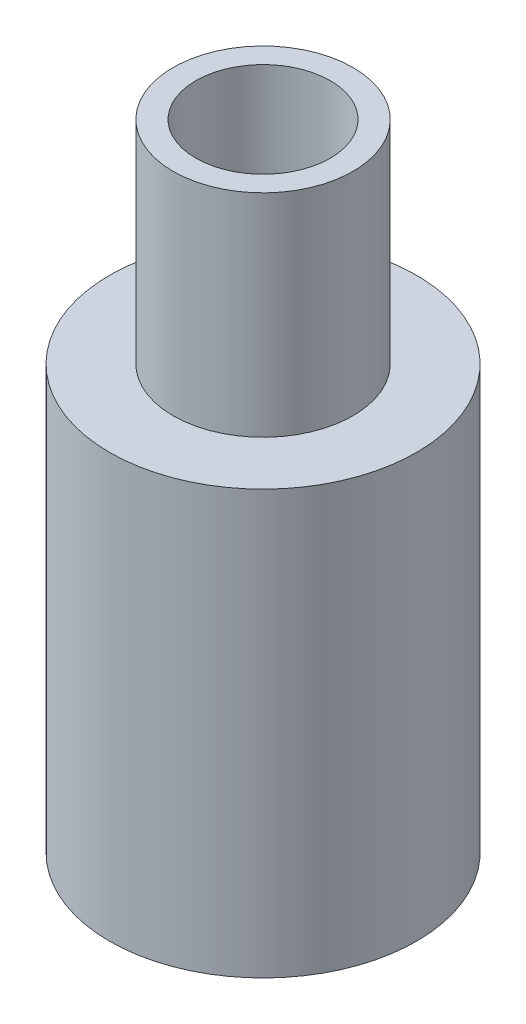
from build123d import *

# Parameters (mm, degrees)
SKETCH1_R           = 7.25
SKETCH1_R_2         = 3.175
BOSS_EXTRUDE1_DEPTH = 30
SKETCH2_OUTSIDE_W   = 23.768
SKETCH2_OUTSIDE_H   = 23.768
SKETCH2_OUTSIDE_R   = 4.25
CUT_EXTRUDE1_DEPTH  = 10
CUT_EXTRUDE2_START  = -9
SKETCH3_R           = 4.25
CUT_EXTRUDE2_DEPTH  = 9


with BuildPart() as part:
    # Sketch1 → Boss-Extrude1 (new body)
    with BuildSketch(Plane(origin=(0, 0, 0), x_dir=(1, 0, 0), z_dir=(0, 1, 0))):
        Circle(SKETCH1_R)
        Circle(SKETCH1_R_2, mode=Mode.SUBTRACT)
    extrude(amount=BOSS_EXTRUDE1_DEPTH)

    # Sketch2 outside → Cut-Extrude1 (cut)
    with BuildSketch(Plane(origin=(0, 30, 0), x_dir=(1, 0, 0), z_dir=(0, 1, 0))):
        Rectangle(SKETCH2_OUTSIDE_W, SKETCH2_OUTSIDE_H)
        Circle(SKETCH2_OUTSIDE_R, mode=Mode.SUBTRACT)
    extrude(amount=-CUT_EXTRUDE1_DEPTH, mode=Mode.SUBTRACT)

    # Sketch3 → Cut-Extrude2 (cut)
    with BuildSketch(Plane.XZ.offset(CUT_EXTRUDE2_START)):
        Circle(SKETCH3_R)
    extrude(amount=CUT_EXTRUDE2_DEPTH, mode=Mode.SUBTRACT)


solid = part.part
